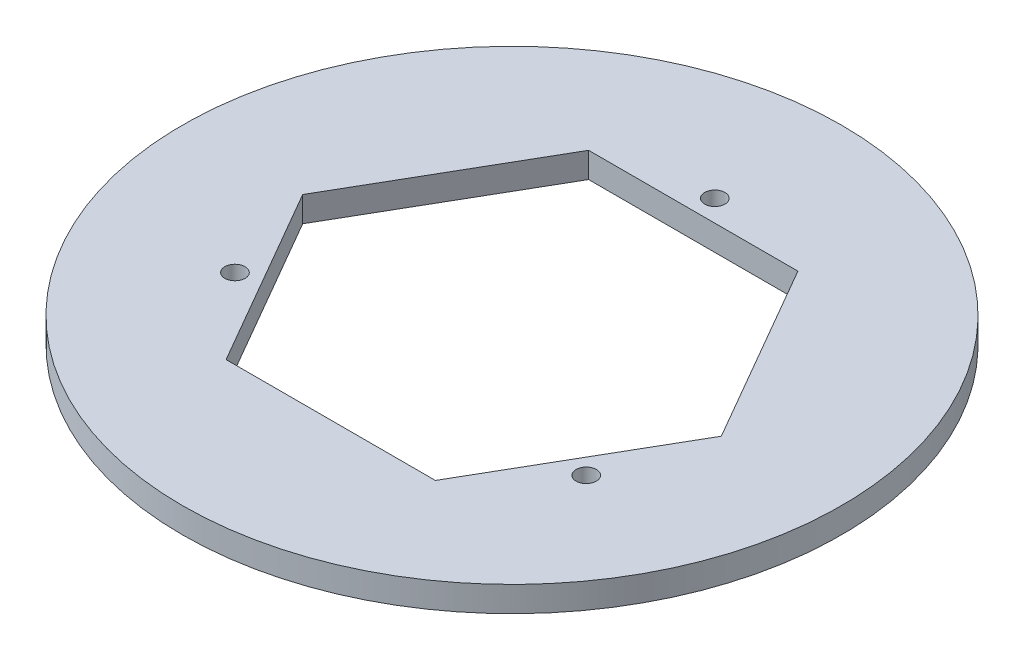
from build123d import *

# Parameters (mm, degrees)
SKIZZE1_R                       = 65
SKIZZE1_R_2                     = 2
AUFSATZ_LINEAR_AUSTRAGEN1_DEPTH = 5


with BuildPart() as part:
    # Skizze1 → Aufsatz-Linear austragen1 (new body)
    with BuildSketch(Plane(origin=(0, 0, 0), x_dir=(1, 0, 0), z_dir=(0, 1, 0))):
        Circle(SKIZZE1_R)
        with Locations((0, 40)):
            Circle(SKIZZE1_R_2, mode=Mode.SUBTRACT)
        with Locations((34.641016151, -20)):
            Circle(SKIZZE1_R_2, mode=Mode.SUBTRACT)
        with Locations((-34.641016151, -20)):
            Circle(SKIZZE1_R_2, mode=Mode.SUBTRACT)
        Polygon((41.280544247, 0), (20.640272124, 35.75), (-20.640272124, 35.75), (-41.280544247, 0), (-20.640272124, -35.75), (20.640272124, -35.75), align=None, mode=Mode.SUBTRACT)
    extrude(amount=AUFSATZ_LINEAR_AUSTRAGEN1_DEPTH)


solid = part.part
